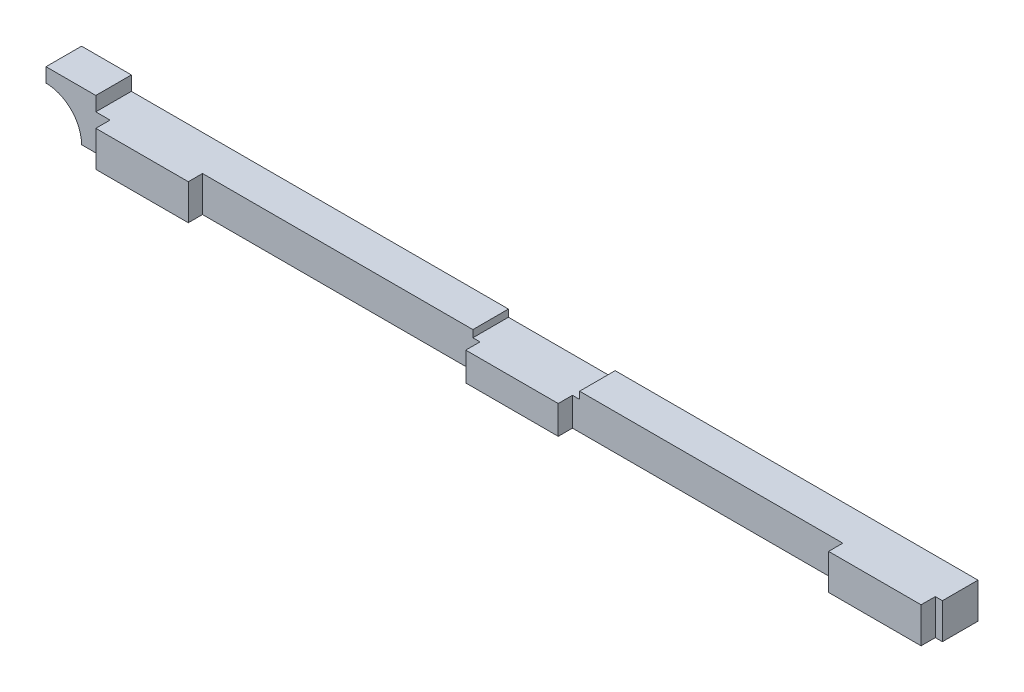
from build123d import *

# Parameters (mm, degrees)
BOSS_EXTRU_1_DEPTH = 5
ESQUISSE3_W        = 13
ESQUISSE3_H        = 5
ESQUISSE3_H_2      = 4
BOSS_EXTRU_2_DEPTH = 2


with BuildPart() as part:
    # Base pièce → Boss.-Extru.1 (new body)
    with BuildSketch(Plane.XY):
        with BuildLine():
            Line((0, 0), (15, 0))
            Line((15, 0), (15, 1))
            Line((15, 1), (66, 1))
            Line((66, 1), (66, -4))
            Line((66, -4), (-55, -4))
            ThreePointArc((-55, -4), (-56.464466094, -0.464466094), (-60, 1))
            Line((-60, 1), (-60, 3))
            Line((-60, 3), (-53, 3))
            Line((-53, 3), (-53, 1))
            Line((-53, 1), (0, 1))
            Line((0, 1), (0, 0))
        make_face()
    extrude(amount=BOSS_EXTRU_1_DEPTH)

    # Esquisse3 → Boss.-Extru.2 (add)
    with BuildSketch(Plane.XY.offset(5)):
        with Locations((-44.5, -1.5)):
            Rectangle(ESQUISSE3_W, ESQUISSE3_H)
        with Locations((7.5, -2)):
            Rectangle(ESQUISSE3_W, ESQUISSE3_H_2)
        with Locations((58.5, -1.5)):
            Rectangle(ESQUISSE3_W, ESQUISSE3_H)
    extrude(amount=BOSS_EXTRU_2_DEPTH)


solid = part.part
